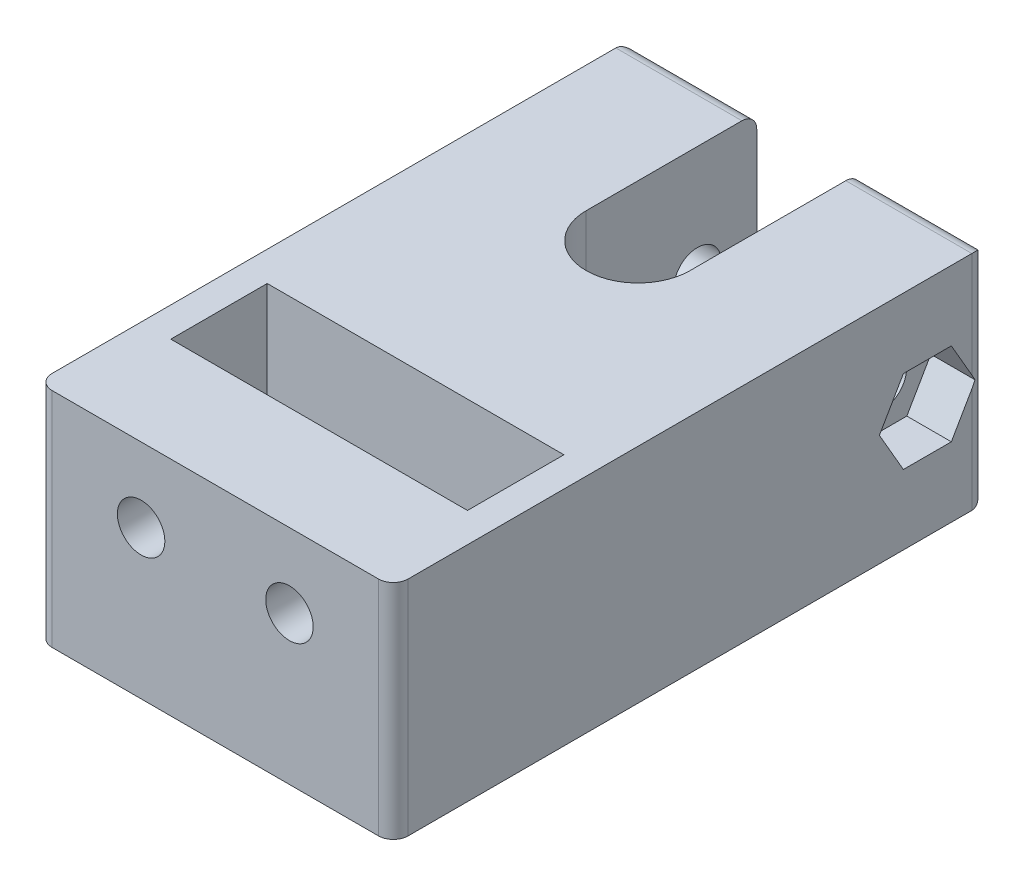
from build123d import *

# Parameters (mm, degrees)
SALIENTE_EXTRUIR2_DEPTH    = 15
CORTAR_EXTRUIR2_DEPTH      = 28.730849248
CORTAR_EXTRUIR2_DEPTH_BACK = 28.730849248
CROQUIS3_R                 = 1.6
CROQUIS4_W                 = 20
CROQUIS4_H                 = 6.5
CORTAR_EXTRUIR3_DEPTH      = 28.730849248
CORTAR_EXTRUIR4_REACH      = 46.373
CROQUIS5_R                 = 1.6
CORTAR_EXTRUIR5_DEPTH      = 3
CORTAR_EXTRUIR6_DEPTH      = 3
REDONDEO1_R                = 1


with BuildPart() as part:
    # Croquis1 → Saliente-Extruir2 (new body)
    with BuildSketch(Plane(origin=(0, 0, 0), x_dir=(1, 0, 0), z_dir=(0, 1, 0))):
        with BuildLine():
            Line((-12, -20), (12, -20))
            Line((12, -20), (12, 20))
            Line((12, 20), (3.5, 20))
            Line((3.5, 20), (3.5, 8.5))
            ThreePointArc((3.5, 8.5), (0, 5), (-3.5, 8.5))
            Line((-3.5, 8.5), (-3.5, 20))
            Line((-3.5, 20), (-12, 20))
            Line((-12, 20), (-12, -20))
        make_face()
    extrude(amount=SALIENTE_EXTRUIR2_DEPTH)

    # Croquis3 → Cortar-Extruir2 (cut, two sides: drawn at the far end of the back side and taken through both)
    with BuildSketch(Plane(origin=(0, 0, 0), x_dir=(0, 0, -1), z_dir=(1, 0, 0)).offset(-CORTAR_EXTRUIR2_DEPTH_BACK)):
        with Locations((16, 7.5)):
            Circle(CROQUIS3_R)
    extrude(amount=CORTAR_EXTRUIR2_DEPTH + CORTAR_EXTRUIR2_DEPTH_BACK, mode=Mode.SUBTRACT)

    # Croquis4 → Cortar-Extruir3 (cut, through all)
    with BuildSketch(Plane(origin=(0, 15, 0), x_dir=(1, 0, 0), z_dir=(0, 1, 0))):
        with Locations((0, -9.75)):
            Rectangle(CROQUIS4_W, CROQUIS4_H)
    extrude(amount=-CORTAR_EXTRUIR3_DEPTH, mode=Mode.SUBTRACT)

    # Croquis5 → Cortar-Extruir4 (cut, up to next)
    with BuildSketch(Plane.XY.offset(20), mode=Mode.PRIVATE) as cortar_extruir4_sk1:
        with Locations((-5, 10)):
            Circle(CROQUIS5_R)
    cortar_extruir4_tool1 = extrude(cortar_extruir4_sk1.sketch, amount=-CORTAR_EXTRUIR4_REACH, mode=Mode.PRIVATE) & part.part
    # Croquis5 → Cortar-Extruir4 (cut, up to next)
    with BuildSketch(Plane.XY.offset(20), mode=Mode.PRIVATE) as cortar_extruir4_sk2:
        with Locations((5, 10)):
            Circle(CROQUIS5_R)
    cortar_extruir4_tool2 = extrude(cortar_extruir4_sk2.sketch, amount=-CORTAR_EXTRUIR4_REACH, mode=Mode.PRIVATE) & part.part
    add(cortar_extruir4_tool1.solids().sort_by_distance((-5, 10, 20))[0], mode=Mode.SUBTRACT)
    add(cortar_extruir4_tool2.solids().sort_by_distance((5, 10, 20))[0], mode=Mode.SUBTRACT)

    # Croquis6 → Cortar-Extruir5 (cut)
    with BuildSketch(Plane(origin=(0, 0, 13), x_dir=(-1, 0, 0), z_dir=(0, 0, -1))):
        Polygon((-3.383419246, 12.8), (-6.616580754, 12.8), (-8.233161507, 10), (-6.616580754, 7.2), (-3.383419246, 7.2), (-1.766838493, 10), align=None)
        Polygon((6.616580754, 12.8), (3.383419246, 12.8), (1.766838493, 10), (3.383419246, 7.2), (6.616580754, 7.2), (8.233161507, 10), align=None)
    extrude(amount=-CORTAR_EXTRUIR5_DEPTH, mode=Mode.SUBTRACT)

    # Croquis7 → Cortar-Extruir6 (cut)
    with BuildSketch(Plane(origin=(12, 0, 0), x_dir=(0, 0, -1), z_dir=(1, 0, 0))):
        Polygon((17.616580754, 4.7), (19.233161507, 7.5), (17.616580754, 10.3), (14.383419246, 10.3), (12.766838493, 7.5), (14.383419246, 4.7), align=None)
    extrude(amount=-CORTAR_EXTRUIR6_DEPTH, mode=Mode.SUBTRACT)

    # Redondeo1
    # the kernel refuses this fillet: 1 mm, written as the material it takes off along each edge
    with BuildSketch(Plane(origin=(14.5, 0, -20), x_dir=(0, 0, 1), z_dir=(-1, 0, 0)), Plane(origin=(-1, 0, -20), x_dir=(0, 0, 1), z_dir=(-1, 0, 0))) as redondeo1_piece_1:
        with BuildLine():
            CenterArc((REDONDEO1_R, REDONDEO1_R), REDONDEO1_R, 180, 90)
            Line((0, REDONDEO1_R), (0, 0))
            Line((0, 0), (REDONDEO1_R, 0))
        make_face()
    extrude(amount=13.5, mode=Mode.SUBTRACT)
    with BuildSketch(Plane(origin=(12, -2.5, -20), x_dir=(0, 0, 1), z_dir=(0, 1, 0)), Plane(origin=(12, -2.5, 20), x_dir=(-1, 0, 0), z_dir=(0, 1, 0))) as redondeo1_piece_2:
        with BuildLine():
            CenterArc((REDONDEO1_R, -REDONDEO1_R), REDONDEO1_R, 90, 90)
            Line((0, -REDONDEO1_R), (0, 0))
            Line((0, 0), (REDONDEO1_R, 0))
        make_face()
    extrude(amount=20, mode=Mode.SUBTRACT)
    with BuildSketch(Plane(origin=(-12, -2.5, 20), x_dir=(1, 0, 0), z_dir=(0, 1, 0)), Plane(origin=(-12, -2.5, -20), x_dir=(0, 0, 1), z_dir=(0, 1, 0))) as redondeo1_piece_3:
        with BuildLine():
            CenterArc((REDONDEO1_R, REDONDEO1_R), REDONDEO1_R, 180, 90)
            Line((0, REDONDEO1_R), (0, 0))
            Line((0, 0), (REDONDEO1_R, 0))
        make_face()
    extrude(amount=20, mode=Mode.SUBTRACT)
    with BuildSketch(Plane(origin=(-1, 15, -20), x_dir=(0, 0, 1), z_dir=(-1, 0, 0)), Plane(origin=(14.5, 15, -20), x_dir=(0, 0, 1), z_dir=(-1, 0, 0))) as redondeo1_piece_4:
        with BuildLine():
            CenterArc((REDONDEO1_R, -REDONDEO1_R), REDONDEO1_R, 90, 90)
            Line((0, -REDONDEO1_R), (0, 0))
            Line((0, 0), (REDONDEO1_R, 0))
        make_face()
    extrude(amount=13.5, mode=Mode.SUBTRACT)


solid = part.part
